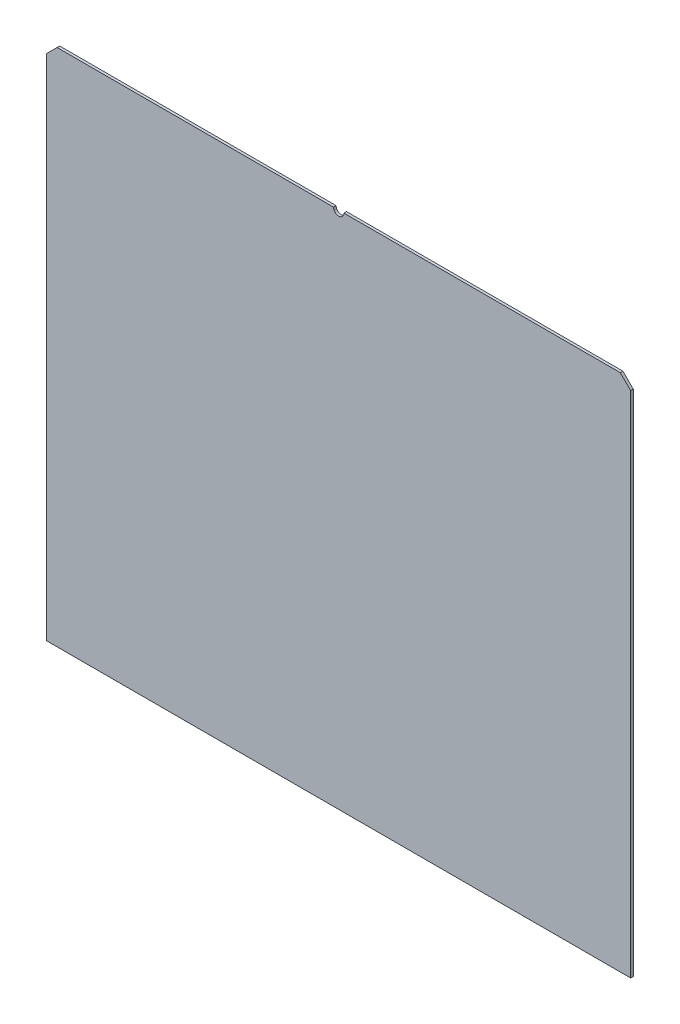
from build123d import *

# Parameters (mm, degrees)
SKETCH1_W          = 225
SKETCH1_H          = 1
BASE_FLANGE1_DEPTH = 200
CHAMFER1_SIZE      = 4
SKETCH2_R          = 2
CUT_EXTRUDE1_DEPTH = 230.471675812


# Sheet-metal steps are written as plain solids
with BuildPart() as part:
    # Sketch1 → Base-Flange1 (new body)
    with BuildSketch(Plane(origin=(0, 0, 0), x_dir=(1, 0, 0), z_dir=(0, 1, 0))):
        with Locations((0, -0.5)):
            Rectangle(SKETCH1_W, SKETCH1_H)
    extrude(amount=BASE_FLANGE1_DEPTH)

    # Chamfer1
    chamfer1_edges = [part.edges().sort_by_distance(p)[0] for p in [
        (-112.5, 200, 0.5),
        (112.5, 200, 0.5),
    ]]
    chamfer(chamfer1_edges, length=CHAMFER1_SIZE)

    # Sketch2 → Cut-Extrude1 (cut, through all)
    with BuildSketch(Plane(origin=(0, 0, 0), x_dir=(-1, 0, 0), z_dir=(0, 0, -1))):
        with Locations((0, 200)):
            Circle(SKETCH2_R)
    extrude(amount=-CUT_EXTRUDE1_DEPTH, mode=Mode.SUBTRACT)


solid = part.part
